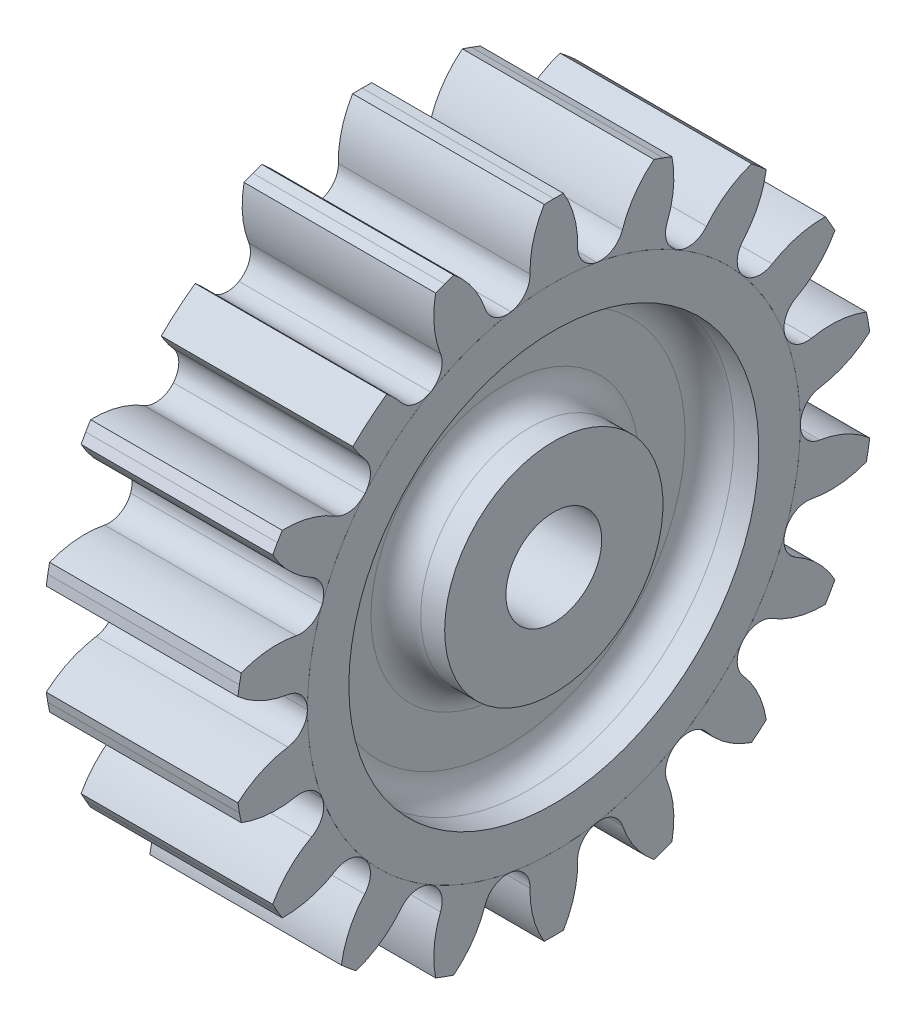
from build123d import *

# Parameters (mm, degrees)
BOSS_EXTRUDE1_START = -25.4
BOSS_EXTRUDE1_DEPTH = 25.4


# Read off the part's stored shape, not the designer's step: Boss-Extrude1
with BuildPart() as part:
    # Sketch1 → Revolve1 (revolve)
    with BuildSketch(Plane.XY, mode=Mode.PRIVATE) as revolve1_sk:
        with BuildLine():
            ThreePointArc((9.447556325, 27.169672131), (7.171516704, 26.17150574), (6.236221051, 23.86891708))
            Line((6.236221051, 23.86891708), (6.236221051, 17.771645663))
            ThreePointArc((6.236221051, 17.771645663), (7.198684781, 15.441458107), (9.525, 14.469672131))
            Line((9.525, 14.469672131), (12.7, 14.469672131))
            Line((12.7, 14.469672131), (12.7, 6.35))
            Line((12.7, 6.35), (-12.7, 6.35))
            Line((-12.7, 6.35), (-12.7, 12.7))
            Line((-12.7, 12.7), (-9.525, 12.7))
            ThreePointArc((-9.525, 12.7), (-7.272655763, 13.710031728), (-6.35, 15.999556788))
            Line((-6.35, 15.999556788), (-6.35, 22.100443212))
            ThreePointArc((-6.35, 22.100443212), (-7.272655763, 24.389968272), (-9.525, 25.4))
            Line((-9.525, 25.4), (-12.7, 25.4))
            Line((-12.7, 25.4), (-12.7, 32.6644))
            Line((-12.7, 32.6644), (12.7, 32.6644))
            Line((12.7, 32.6644), (12.7, 27.169672131))
            Line((12.7, 27.169672131), (9.447556325, 27.169672131))
        make_face()
    revolve(revolve1_sk.sketch.rotate(Axis((-32.738934426, 0, 0), (1, 0, 0)), 90), axis=Axis((-32.738934426, 0, 0), (1, 0, 0)))


with BuildPart() as body_2:
    # Boss-Extrude1 outline → Boss-Extrude1 (new body)
    with BuildSketch(Plane.ZY.offset(12.7).offset(BOSS_EXTRUDE1_START)):
        with BuildLine():
            ThreePointArc((-30.694495642, -11.17188277), (-30.707149649, -13.290968629), (-32.098156717, -14.889650691))
            ThreePointArc((-32.098156717, -14.889650691), (-35.051812301, -17.098736065), (-37.265501512, -20.048942765))
            Line((-37.265501512, -20.048942765), (-36.647077397, -21.1582))
            Line((-36.647077397, -21.1582), (-35.995643242, -22.24839964))
            ThreePointArc((-35.995643242, -22.24839964), (-32.333845343, -21.806391704), (-28.94389411, -20.352993786))
            ThreePointArc((-28.94389411, -20.352993786), (-26.863891297, -19.947687359), (-25.022382108, -20.996271598))
            ThreePointArc((-25.022382108, -20.996271598), (-28.288200199, -16.3322), (-30.694495642, -11.17188277))
        make_face()
        with BuildLine():
            ThreePointArc((-34.159497564, -9.22616326), (-32.066311307, -9.556702661), (-30.694495642, -11.17188277))
            ThreePointArc((-30.694495642, -11.17188277), (-32.168154367, -5.672113535), (-32.6644, 0))
            ThreePointArc((-32.6644, 0), (-33.401060925, -1.986961419), (-35.254961471, -3.013478719))
            ThreePointArc((-35.254961471, -3.013478719), (-38.786041524, -4.079130238), (-41.875259059, -6.094291403))
            Line((-41.875259059, -6.094291403), (-41.6735188, -7.348165745))
            Line((-41.6735188, -7.348165745), (-41.434241169, -8.595421905))
            ThreePointArc((-41.434241169, -8.595421905), (-37.842101087, -9.432478952), (-34.159497564, -9.22616326))
        make_face()
        with BuildLine():
            ThreePointArc((-16.3322, -28.288200199), (-20.996271598, -25.022382108), (-25.022382108, -20.996271598))
            ThreePointArc((-25.022382108, -20.996271598), (-24.309502935, -22.991888867), (-25.069840545, -24.969911041))
            ThreePointArc((-25.069840545, -24.969911041), (-27.089817205, -28.055981972), (-28.160974503, -31.585395739))
            Line((-28.160974503, -31.585395739), (-27.200457607, -32.416243073))
            Line((-27.200457607, -32.416243073), (-26.215439502, -33.217892027))
            ThreePointArc((-26.215439502, -33.217892027), (-22.925650655, -31.550131789), (-20.23722986, -29.024952884))
            ThreePointArc((-20.23722986, -29.024952884), (-18.421289528, -27.932686565), (-16.3322, -28.288200199))
        make_face()
        with BuildLine():
            ThreePointArc((-35.254961471, 3.013478719), (-33.401060925, 1.986961419), (-32.6644, 0))
            ThreePointArc((-32.6644, 0), (-32.168154367, 5.672113535), (-30.694495642, 11.17188277))
            ThreePointArc((-30.694495642, 11.17188277), (-32.066311307, 9.556702661), (-34.159497564, 9.22616326))
            ThreePointArc((-34.159497564, 9.22616326), (-37.842101718, 9.432478897), (-41.43424235, 8.595421445))
            Line((-41.43424235, 8.595421445), (-41.6735188, 7.348165745))
            Line((-41.6735188, 7.348165745), (-41.875258106, 6.094290566))
            ThreePointArc((-41.875258106, 6.094290566), (-38.786040949, 4.079129971), (-35.254961471, 3.013478719))
        make_face()
        with BuildLine():
            ThreePointArc((-5.672113535, -32.168154367), (-11.17188277, -30.694495642), (-16.3322, -28.288200199))
            ThreePointArc((-16.3322, -28.288200199), (-14.979771397, -29.919647984), (-15.017731611, -32.038431603))
            ThreePointArc((-15.017731611, -32.038431603), (-15.860390351, -35.629262391), (-15.659818357, -39.312183836))
            Line((-15.659818357, -39.312183836), (-14.473061193, -39.764408818))
            Line((-14.473061193, -39.764408818), (-13.273266858, -40.180816392))
            ThreePointArc((-13.273266858, -40.180816392), (-10.75228415, -37.48846035), (-9.08965702, -34.196074301))
            ThreePointArc((-9.08965702, -34.196074301), (-7.756808373, -32.548591529), (-5.672113535, -32.168154367))
        make_face()
        with BuildLine():
            ThreePointArc((-32.098156717, 14.889650691), (-30.707149649, 13.290968629), (-30.694495642, 11.17188277))
            ThreePointArc((-30.694495642, 11.17188277), (-28.288200199, 16.3322), (-25.022382108, 20.996271598))
            ThreePointArc((-25.022382108, 20.996271598), (-26.863891297, 19.947687359), (-28.94389411, 20.352993786))
            ThreePointArc((-28.94389411, 20.352993786), (-32.333845955, 21.806391869), (-35.99564451, 22.248399612))
            Line((-35.99564451, 22.248399612), (-36.647077397, 21.1582))
            Line((-36.647077397, 21.1582), (-37.265500903, 20.048941653))
            ThreePointArc((-37.265500903, 20.048941653), (-35.051811852, 17.098735617), (-32.098156717, 14.889650691))
        make_face()
        with BuildLine():
            ThreePointArc((5.672113535, -32.168154367), (0, -32.6644), (-5.672113535, -32.168154367))
            ThreePointArc((-5.672113535, -32.168154367), (-3.843258351, -33.238655987), (-3.154262607, -35.242644477))
            ThreePointArc((-3.154262607, -35.242644477), (-2.717966346, -38.905127934), (-1.269857003, -42.297342377))
            Line((-1.269857003, -42.297342377), (0, -42.3164))
            Line((0, -42.3164), (1.269857661, -42.297341294))
            ThreePointArc((1.269857661, -42.297341294), (2.717966509, -38.905127321), (3.154262607, -35.242644477))
            ThreePointArc((3.154262607, -35.242644477), (3.843258351, -33.238655987), (5.672113535, -32.168154367))
        make_face()
        with BuildLine():
            ThreePointArc((-25.069840545, 24.969911041), (-24.309502935, 22.991888867), (-25.022382108, 20.996271598))
            ThreePointArc((-25.022382108, 20.996271598), (-20.996271598, 25.022382108), (-16.3322, 28.288200199))
            ThreePointArc((-16.3322, 28.288200199), (-18.421289528, 27.932686565), (-20.23722986, 29.024952884))
            ThreePointArc((-20.23722986, 29.024952884), (-22.925651173, 31.550132153), (-26.215440702, 33.217892434))
            Line((-26.215440702, 33.217892434), (-27.200457607, 32.416243073))
            Line((-27.200457607, 32.416243073), (-28.160974311, 31.585394486))
            ThreePointArc((-28.160974311, 31.585394486), (-27.089816936, 28.055981398), (-25.069840545, 24.969911041))
        make_face()
        with BuildLine():
            ThreePointArc((16.3322, -28.288200199), (11.17188277, -30.694495642), (5.672113535, -32.168154367))
            ThreePointArc((5.672113535, -32.168154367), (7.756808373, -32.548591529), (9.08965702, -34.196074301))
            ThreePointArc((9.08965702, -34.196074301), (10.752284514, -37.488460869), (13.273267847, -40.180817185))
            Line((13.273267847, -40.180817185), (14.473061193, -39.764408818))
            Line((14.473061193, -39.764408818), (15.659818605, -39.312182593))
            ThreePointArc((15.659818605, -39.312182593), (15.860390295, -35.629261759), (15.017731611, -32.038431603))
            ThreePointArc((15.017731611, -32.038431603), (14.979771397, -29.919647984), (16.3322, -28.288200199))
        make_face()
        with BuildLine():
            ThreePointArc((-15.017731611, 32.038431603), (-14.979771397, 29.919647984), (-16.3322, 28.288200199))
            ThreePointArc((-16.3322, 28.288200199), (-11.17188277, 30.694495642), (-5.672113535, 32.168154367))
            ThreePointArc((-5.672113535, 32.168154367), (-7.756808373, 32.548591529), (-9.08965702, 34.196074301))
            ThreePointArc((-9.08965702, 34.196074301), (-10.752284514, 37.488460869), (-13.273267847, 40.180817185))
            Line((-13.273267847, 40.180817185), (-14.473061193, 39.764408818))
            Line((-14.473061193, 39.764408818), (-15.659818605, 39.312182593))
            ThreePointArc((-15.659818605, 39.312182593), (-15.860390295, 35.629261759), (-15.017731611, 32.038431603))
        make_face()
        with BuildLine():
            ThreePointArc((25.022382108, -20.996271598), (20.996271598, -25.022382108), (16.3322, -28.288200199))
            ThreePointArc((16.3322, -28.288200199), (18.421289528, -27.932686565), (20.23722986, -29.024952884))
            ThreePointArc((20.23722986, -29.024952884), (22.925651173, -31.550132153), (26.215440702, -33.217892434))
            Line((26.215440702, -33.217892434), (27.200457607, -32.416243073))
            Line((27.200457607, -32.416243073), (28.160974311, -31.585394486))
            ThreePointArc((28.160974311, -31.585394486), (27.089816936, -28.055981398), (25.069840545, -24.969911041))
            ThreePointArc((25.069840545, -24.969911041), (24.309502935, -22.991888867), (25.022382108, -20.996271598))
        make_face()
        with BuildLine():
            ThreePointArc((-3.154262607, 35.242644477), (-3.843258351, 33.238655987), (-5.672113535, 32.168154367))
            ThreePointArc((-5.672113535, 32.168154367), (0, 32.6644), (5.672113535, 32.168154367))
            ThreePointArc((5.672113535, 32.168154367), (3.843258351, 33.238655987), (3.154262607, 35.242644477))
            ThreePointArc((3.154262607, 35.242644477), (2.717966346, 38.905127934), (1.269857003, 42.297342377))
            Line((1.269857003, 42.297342377), (0, 42.3164))
            Line((0, 42.3164), (-1.269857661, 42.297341294))
            ThreePointArc((-1.269857661, 42.297341294), (-2.717966509, 38.905127321), (-3.154262607, 35.242644477))
        make_face()
        with BuildLine():
            ThreePointArc((30.694495642, -11.17188277), (28.288200199, -16.3322), (25.022382108, -20.996271598))
            ThreePointArc((25.022382108, -20.996271598), (26.863891297, -19.947687359), (28.94389411, -20.352993786))
            ThreePointArc((28.94389411, -20.352993786), (32.333845955, -21.806391869), (35.99564451, -22.248399612))
            Line((35.99564451, -22.248399612), (36.647077397, -21.1582))
            Line((36.647077397, -21.1582), (37.265500903, -20.048941653))
            ThreePointArc((37.265500903, -20.048941653), (35.051811852, -17.098735617), (32.098156717, -14.889650691))
            ThreePointArc((32.098156717, -14.889650691), (30.707149649, -13.290968629), (30.694495642, -11.17188277))
        make_face()
        with BuildLine():
            ThreePointArc((9.08965702, 34.196074301), (7.756808373, 32.548591529), (5.672113535, 32.168154367))
            ThreePointArc((5.672113535, 32.168154367), (11.17188277, 30.694495642), (16.3322, 28.288200199))
            ThreePointArc((16.3322, 28.288200199), (14.979771397, 29.919647984), (15.017731611, 32.038431603))
            ThreePointArc((15.017731611, 32.038431603), (15.860390351, 35.629262391), (15.659818357, 39.312183836))
            Line((15.659818357, 39.312183836), (14.473061193, 39.764408818))
            Line((14.473061193, 39.764408818), (13.273266858, 40.180816392))
            ThreePointArc((13.273266858, 40.180816392), (10.75228415, 37.48846035), (9.08965702, 34.196074301))
        make_face()
        with BuildLine():
            ThreePointArc((32.6644, 0), (32.168154367, -5.672113535), (30.694495642, -11.17188277))
            ThreePointArc((30.694495642, -11.17188277), (32.066311307, -9.556702661), (34.159497564, -9.22616326))
            ThreePointArc((34.159497564, -9.22616326), (37.842101718, -9.432478897), (41.43424235, -8.595421445))
            Line((41.43424235, -8.595421445), (41.6735188, -7.348165745))
            Line((41.6735188, -7.348165745), (41.875258106, -6.094290566))
            ThreePointArc((41.875258106, -6.094290566), (38.786040949, -4.079129971), (35.254961471, -3.013478719))
            ThreePointArc((35.254961471, -3.013478719), (33.401060925, -1.986961419), (32.6644, 0))
        make_face()
        with BuildLine():
            ThreePointArc((20.23722986, 29.024952884), (18.421289528, 27.932686565), (16.3322, 28.288200199))
            ThreePointArc((16.3322, 28.288200199), (20.996271598, 25.022382108), (25.022382108, 20.996271598))
            ThreePointArc((25.022382108, 20.996271598), (24.309502935, 22.991888867), (25.069840545, 24.969911041))
            ThreePointArc((25.069840545, 24.969911041), (25.911299572, 26.032401392), (26.637471285, 27.176784931))
            ThreePointArc((26.637471285, 27.176784931), (24.460855906, 29.151312904), (22.138360156, 30.951987421))
            ThreePointArc((22.138360156, 30.951987421), (21.137460769, 30.038127771), (20.23722986, 29.024952884))
        make_face()
        with BuildLine():
            ThreePointArc((30.694495642, 11.17188277), (32.168154367, 5.672113535), (32.6644, 0))
            ThreePointArc((32.6644, 0), (33.401060925, 1.986961419), (35.254961471, 3.013478719))
            ThreePointArc((35.254961471, 3.013478719), (38.786041524, 4.079130238), (41.875259059, 6.094291403))
            Line((41.875259059, 6.094291403), (41.6735188, 7.348165745))
            Line((41.6735188, 7.348165745), (41.434241169, 8.595421905))
            ThreePointArc((41.434241169, 8.595421905), (37.842101087, 9.432478952), (34.159497564, 9.22616326))
            ThreePointArc((34.159497564, 9.22616326), (32.066311307, 9.556702661), (30.694495642, 11.17188277))
        make_face()
        with BuildLine():
            ThreePointArc((28.94389411, 20.352993786), (26.863891297, 19.947687359), (25.022382108, 20.996271598))
            ThreePointArc((25.022382108, 20.996271598), (28.288200199, 16.3322), (30.694495642, 11.17188277))
            ThreePointArc((30.694495642, 11.17188277), (30.707149649, 13.290968629), (32.098156717, 14.889650691))
            ThreePointArc((32.098156717, 14.889650691), (35.051812301, 17.098736065), (37.265501512, 20.048942765))
            Line((37.265501512, 20.048942765), (36.647077397, 21.1582))
            Line((36.647077397, 21.1582), (35.995643242, 22.24839964))
            ThreePointArc((35.995643242, 22.24839964), (32.333845343, 21.806391704), (28.94389411, 20.352993786))
        make_face()
    extrude(amount=BOSS_EXTRUDE1_DEPTH)


solid = Compound([part.part, body_2.part])
